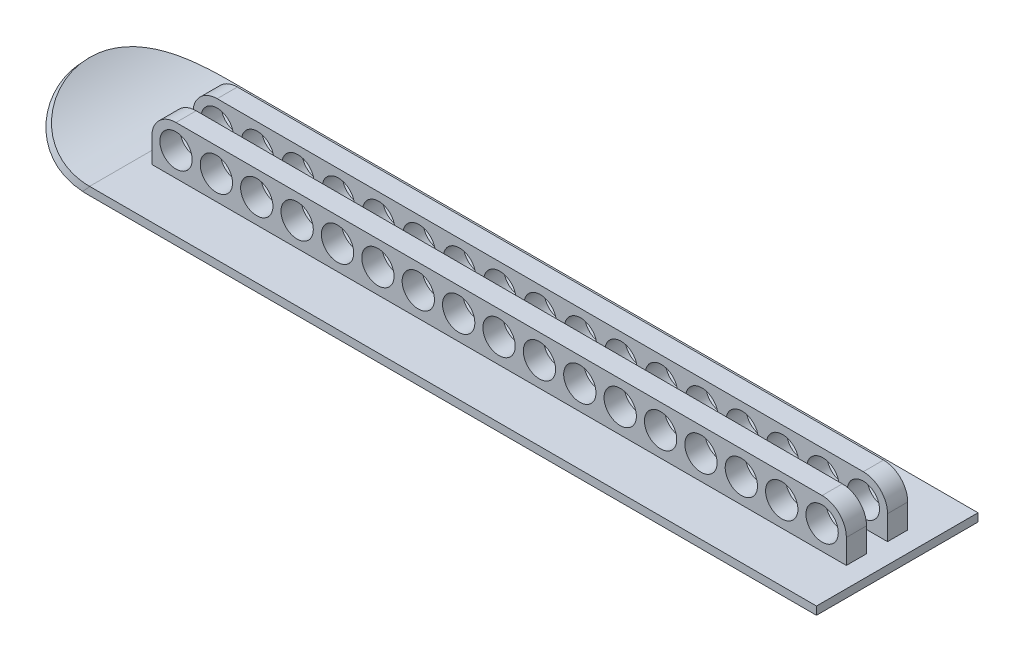
from build123d import *

# Parameters (mm, degrees)
SKETCH1_W           = 228.6
SKETCH1_H           = 2.54
BOSS_EXTRUDE1_DEPTH = 50.8
FILLET1_START       = -165
FILLET1_DEPTH       = 13.186938489
SKETCH2_W           = 218.44
SKETCH2_H           = 6.35
BOSS_EXTRUDE2_DEPTH = 15.24
SKETCH3_R           = 5.08
CUT_EXTRUDE1_DEPTH  = 259.7106756
FILLET2_R           = 7.62


with BuildPart() as part:
    # Sketch1 → Boss-Extrude1 (new body)
    with BuildSketch(Plane.XY):
        with Locations((-114.3, 1.27)):
            Rectangle(SKETCH1_W, SKETCH1_H)
        with BuildLine():
            ThreePointArc((-254, 12.271139473), (-242.20013856, 5.05604844), (-228.6, 2.54))
            Line((-228.6, 2.54), (-228.6, 0))
            ThreePointArc((-228.6, 0), (-243.115499591, 2.686710605), (-255.707728681, 10.39085941))
            Line((-255.707728681, 10.39085941), (-254, 12.271139473))
        make_face()
    extrude(amount=BOSS_EXTRUDE1_DEPTH)

    # Fillet1: read off the stored shape, not the designer's step
    # Fillet1 outline → Fillet1 (cut)
    with BuildSketch(Plane(origin=(0, 0, 0), x_dir=(0.7402568203074695, -0.6723242074983429, 0), z_dir=(0.6723242074983428, 0.7402568203074698, 0)).offset(FILLET1_START)):
        with BuildLine():
            Line((-196.275416479, 0), (-196.275416479, -25.4))
            ThreePointArc((-196.275416479, -25.4), (-188.835928722, -7.439487757), (-170.875416479, 0))
            Line((-170.875416479, 0), (-196.275416479, 0))
        make_face()
        with BuildLine():
            ThreePointArc((-170.875416479, -50.8), (-188.835928722, -43.360512243), (-196.275416479, -25.4))
            Line((-196.275416479, -25.4), (-196.275416479, -50.8))
            Line((-196.275416479, -50.8), (-170.875416479, -50.8))
        make_face()
    extrude(amount=FILLET1_DEPTH, mode=Mode.SUBTRACT)

    # Sketch2 → Boss-Extrude2 (add)
    with BuildSketch(Plane(origin=(0, 2.54, 0), x_dir=(1, 0, 0), z_dir=(0, 1, 0))):
        with Locations((-115.57, -18.923)):
            Rectangle(SKETCH2_W, SKETCH2_H)
        with Locations((-115.57, -31.877)):
            Rectangle(SKETCH2_W, SKETCH2_H)
    extrude(amount=BOSS_EXTRUDE2_DEPTH)

    # Sketch3 → Cut-Extrude1 (cut, through all)
    with BuildSketch(Plane.XY.offset(35.052)):
        with Locations((-13.97, 10.16)):
            Circle(SKETCH3_R)
        with Locations((-26.67, 10.16)):
            Circle(SKETCH3_R)
        with Locations((-39.37, 10.16)):
            Circle(SKETCH3_R)
        with Locations((-52.07, 10.16)):
            Circle(SKETCH3_R)
        with Locations((-64.77, 10.16)):
            Circle(SKETCH3_R)
        with Locations((-77.47, 10.16)):
            Circle(SKETCH3_R)
        with Locations((-90.17, 10.16)):
            Circle(SKETCH3_R)
        with Locations((-102.87, 10.16)):
            Circle(SKETCH3_R)
        with Locations((-115.57, 10.16)):
            Circle(SKETCH3_R)
        with Locations((-128.27, 10.16)):
            Circle(SKETCH3_R)
        with Locations((-140.97, 10.16)):
            Circle(SKETCH3_R)
        with Locations((-153.67, 10.16)):
            Circle(SKETCH3_R)
        with Locations((-166.37, 10.16)):
            Circle(SKETCH3_R)
        with Locations((-179.07, 10.16)):
            Circle(SKETCH3_R)
        with Locations((-191.77, 10.16)):
            Circle(SKETCH3_R)
        with Locations((-204.47, 10.16)):
            Circle(SKETCH3_R)
        with Locations((-217.17, 10.16)):
            Circle(SKETCH3_R)
    extrude(amount=-CUT_EXTRUDE1_DEPTH, mode=Mode.SUBTRACT)

    # Fillet2
    fillet2_edges = [part.edges().sort_by_distance(p)[0] for p in [
        (-6.35, 17.78, 18.923),
        (-224.79, 17.78, 18.923),
        (-6.35, 17.78, 31.877),
        (-224.79, 17.78, 31.877),
    ]]
    fillet(fillet2_edges, radius=FILLET2_R)


solid = part.part
